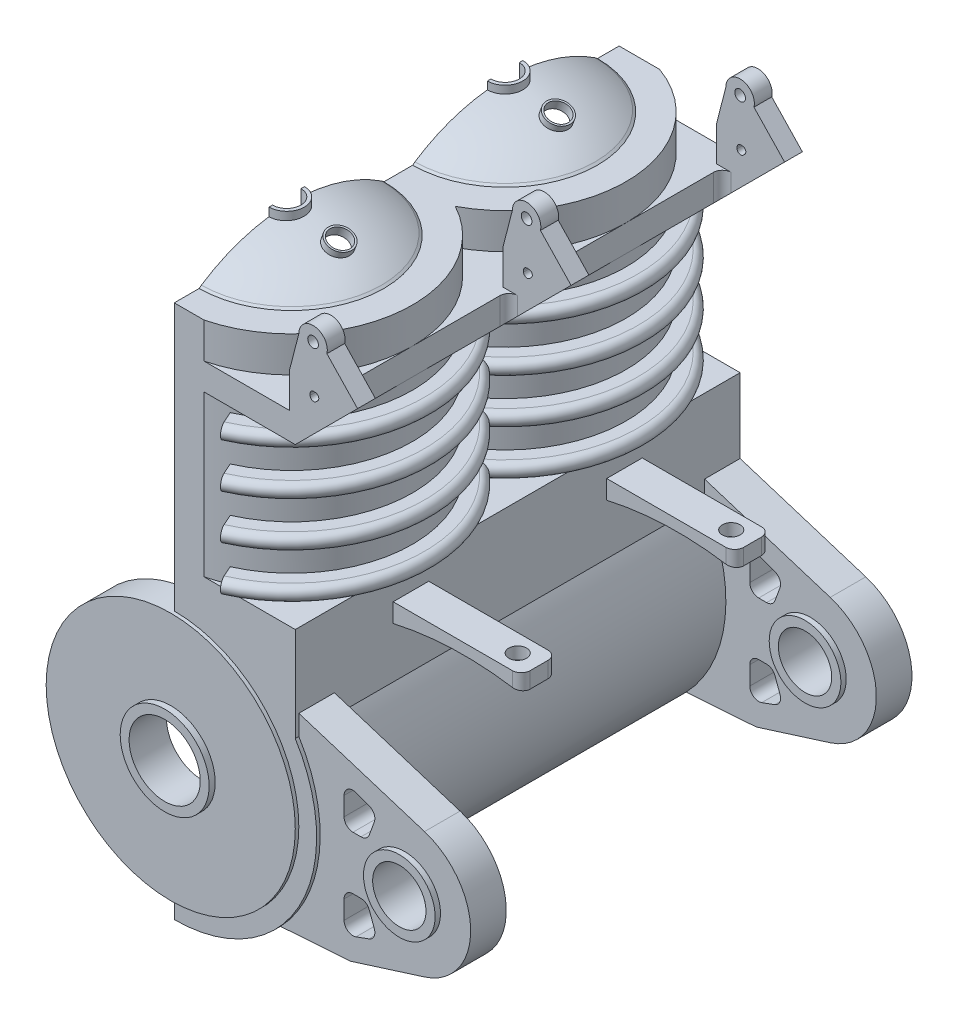
from build123d import *
from build123d.topology import SkipClean

# Parameters (mm, degrees)
BOSS_EXTRUDE1_DEPTH  = 25
SKETCH7_R            = 5
CUT_EXTRUDE1_DEPTH   = 20
SKETCH8_R            = 7
CUT_EXTRUDE3_DEPTH   = 30
CUT_EXTRUDE4_DEPTH   = 9
SKETCH10_W           = 0.505
SKETCH10_H           = 10
SKETCH10_W_2         = 0.175
SKETCH10_H_2         = 0.8
REVOLVE4_ANGLE       = 156
LPATTERN1_COUNT      = 2
LPATTERN1_PITCH      = 12
SKETCH11_R           = 5
CUT_EXTRUDE5_DEPTH   = 15
BOSS_EXTRUDE2_START  = -1
SKETCH12_R           = 7
SKETCH12_R_2         = 2.5
BOSS_EXTRUDE2_DEPTH  = 1.5
LPATTERN2_COUNT      = 3
LPATTERN2_PITCH      = 12
BOSS_EXTRUDE3_START  = 0.2
SKETCH13_R           = 2.5
BOSS_EXTRUDE3_DEPTH  = 0.2
BOSS_EXTRUDE4_START  = -1.6
SKETCH14_R           = 2.5
SKETCH14_R_2         = 2
BOSS_EXTRUDE4_DEPTH  = 2.1
LPATTERN4_COUNT      = 3
LPATTERN4_PITCH      = 12.22
BOSS_EXTRUDE5_START  = 2
BOSS_EXTRUDE5_DEPTH  = 2
SKETCH16_R           = 2.013
BOSS_EXTRUDE6_DEPTH  = 2
LPATTERN5_COUNT      = 2
LPATTERN5_PITCH      = 22.8
BOSS_EXTRUDE7_START  = 0.3
SKETCH17_R           = 2.013
SKETCH17_R_2         = 1.5
BOSS_EXTRUDE7_DEPTH  = 2.6
LPATTERN7_COUNT      = 2
LPATTERN7_PITCH      = 22.8
CUT_EXTRUDE7_DEPTH   = 38.62472532
REVOLVE6_ANGLE       = 180
LPATTERN8_COUNT      = 2
LPATTERN8_PITCH      = 12
SKETCH22_R           = 0.995
CUT_EXTRUDE8_DEPTH   = 46.655730199
BOSS_EXTRUDE8_START  = 1.2
BOSS_EXTRUDE8_DEPTH  = 0.8
SKETCH24_R           = 0.6
CUT_EXTRUDE9_DEPTH   = 44.130998955
SKETCH25_R           = 0.3
BOSS_EXTRUDE9_DEPTH  = 1
LPATTERN9_COUNT      = 3
LPATTERN9_PITCH      = 12
FILLET1_R            = 0.5
FILLET2_R            = 0.5
BOSS_EXTRUDE10_START = -5.5
BOSS_EXTRUDE10_DEPTH = 2
LPATTERN10_COUNT     = 2
LPATTERN10_PITCH     = 12
SKETCH27_R           = 0.5
CUT_EXTRUDE10_DEPTH  = 2.5
FILLET3_R            = 0.5
SKETCH28_W           = 4.347095231
SKETCH28_H           = 2.543911844
CUT_EXTRUDE11_DEPTH  = 39.271201321
SKETCH29_R           = 0.3
BOSS_EXTRUDE11_DEPTH = 1
LPATTERN11_COUNT     = 3
LPATTERN11_PITCH     = 12
EXTRUDE_THIN1_START  = 1.9
SKETCH31_R           = 0.7
SKETCH31_R_2         = 0.6
EXTRUDE_THIN1_DEPTH  = 0.5


with BuildPart() as part:
    # Sketch6 → Boss-Extrude1 (new body)
    with BuildSketch(Plane.XY):
        with BuildLine():
            Line((-15.966014508, -15.243839916), (-15.966014508, 12.776160084))
            Line((-15.966014508, 12.776160084), (-9.166014508, 12.776160084))
            Line((-9.166014508, 12.776160084), (-9.166014508, -3.029578414))
            ThreePointArc((-9.166014508, -3.029578414), (-8.976232966, -11.135234781), (-15.966014508, -15.243839916))
        make_face()
    extrude(amount=BOSS_EXTRUDE1_DEPTH)

    # Sketch7 → Cut-Extrude1 (cut)
    with BuildSketch(Plane(origin=(0, 12.776160084, 0), x_dir=(1, 0, 0), z_dir=(0, 1, 0))):
        with Locations((-15.966014508, -6.41)):
            Circle(SKETCH7_R)
        with Locations((-15.966014508, -18.41)):
            Circle(SKETCH7_R)
    extrude(amount=-CUT_EXTRUDE1_DEPTH, mode=Mode.SUBTRACT)

    # Sketch8 → Cut-Extrude3 (cut)
    with BuildSketch(Plane.XY.offset(25)):
        with Locations((-15.966014508, -7.223839916)):
            Circle(SKETCH8_R)
    extrude(amount=-CUT_EXTRUDE3_DEPTH, mode=Mode.SUBTRACT)

    # Sketch9 → Cut-Extrude4 (cut)
    with BuildSketch(Plane(origin=(0, 11.276160084, 0), x_dir=(1, 0, 0), z_dir=(0, 1, 0))):
        with BuildLine():
            Line((-15.966014508, 0.39), (-5.239812243, 0.39))
            Line((-5.239812243, 0.39), (-5.239812243, -25.21))
            Line((-5.239812243, -25.21), (-15.966014508, -25.21))
            ThreePointArc((-15.966014508, -25.21), (-9.369045507, -20.05924225), (-12.766014508, -12.41))
            ThreePointArc((-12.766014508, -12.41), (-9.369045507, -4.76075775), (-15.966014508, 0.39))
        make_face()
    extrude(amount=-CUT_EXTRUDE4_DEPTH, mode=Mode.SUBTRACT)

    # Sketch10 → Revolve4 (revolve)
    with BuildSketch(Plane.ZY.offset(15.966014508)):
        with Locations((0.4275, 6.926160084)):
            Rectangle(SKETCH10_W, SKETCH10_H)
        with BuildLine():
            Line((0, 9.826160084), (0, 10.626160084))
            Line((0, 10.626160084), (-1.07, 10.626160084))
            ThreePointArc((-1.07, 10.626160084), (-1.47, 10.226160084), (-1.07, 9.826160084))
            Line((-1.07, 9.826160084), (0, 9.826160084))
        make_face()
        with Locations((0.0875, 10.226160084)):
            Rectangle(SKETCH10_W_2, SKETCH10_H_2)
        with BuildLine():
            Line((0, 7.326160084), (0, 8.126160084))
            Line((0, 8.126160084), (-1.07, 8.126160084))
            ThreePointArc((-1.07, 8.126160084), (-1.47, 7.726160084), (-1.07, 7.326160084))
            Line((-1.07, 7.326160084), (0, 7.326160084))
        make_face()
        with Locations((0.0875, 7.726160084)):
            Rectangle(SKETCH10_W_2, SKETCH10_H_2)
        with BuildLine():
            Line((0, 4.826160084), (0, 5.626160084))
            Line((0, 5.626160084), (-1.07, 5.626160084))
            ThreePointArc((-1.07, 5.626160084), (-1.47, 5.226160084), (-1.07, 4.826160084))
            Line((-1.07, 4.826160084), (0, 4.826160084))
        make_face()
        with Locations((0.0875, 5.226160084)):
            Rectangle(SKETCH10_W_2, SKETCH10_H_2)
        with BuildLine():
            Line((-1.07, 2.326160084), (0, 2.326160084))
            Line((0, 2.326160084), (0, 3.126160084))
            Line((0, 3.126160084), (-1.07, 3.126160084))
            ThreePointArc((-1.07, 3.126160084), (-1.47, 2.726160084), (-1.07, 2.326160084))
        make_face()
        with Locations((0.0875, 2.726160084)):
            Rectangle(SKETCH10_W_2, SKETCH10_H_2)
    revolve4 = revolve(axis=Axis((-15.966014508, 12.776160084, 6.41), (0, -1, 0)), revolution_arc=REVOLVE4_ANGLE)

    # LPattern1: Revolve4 ×2
    with Locations(*[(0, 0, i * LPATTERN1_PITCH) for i in range(1, LPATTERN1_COUNT)]):
        add(revolve4)

    # Sketch11 → Cut-Extrude5 (cut)
    with BuildSketch(Plane(origin=(0, 12.776160084, 0), x_dir=(1, 0, 0), z_dir=(0, 1, 0))):
        with Locations((-15.966014508, -6.41)):
            Circle(SKETCH11_R)
    extrude(amount=-CUT_EXTRUDE5_DEPTH, mode=Mode.SUBTRACT)

    # Sketch12 → Boss-Extrude2 (add)
    with BuildSketch(Plane(origin=(0, 0, 0), x_dir=(-1, 0, 0), z_dir=(0, 0, -1)).offset(BOSS_EXTRUDE2_START)):
        with Locations((15.966014508, -7.223839916)):
            Circle(SKETCH12_R)
        with Locations((15.966014508, -7.223839916)):
            Circle(SKETCH12_R_2, mode=Mode.SUBTRACT)
    boss_extrude2 = extrude(amount=BOSS_EXTRUDE2_DEPTH)

    # LPattern2: Boss-Extrude2 ×3
    with Locations(*[(0, 0, i * LPATTERN2_PITCH) for i in range(1, LPATTERN2_COUNT)]):
        add(boss_extrude2)

    # Sketch13 → Boss-Extrude3 (add)
    with BuildSketch(Plane.XY.offset(25).offset(BOSS_EXTRUDE3_START)):
        with BuildLine():
            ThreePointArc((-15.966014508, -14.223839916), (-8.966014508, -7.223839916), (-15.966014508, -0.223839916))
            ThreePointArc((-15.966014508, -0.223839916), (-22.966014508, -7.223839916), (-15.966014508, -14.223839916))
        make_face()
        with Locations(Location((-15.966014508, -7.223839916, 0), (0, 0, 180))):
            Circle(SKETCH13_R, mode=Mode.SUBTRACT)
    extrude(amount=-BOSS_EXTRUDE3_DEPTH)

    # Sketch14 → Boss-Extrude4 (add)
    with BuildSketch(Plane(origin=(0, 0, -0.5), x_dir=(-1, 0, 0), z_dir=(0, 0, -1)).offset(BOSS_EXTRUDE4_START)):
        with Locations((15.966014508, -7.223839916)):
            Circle(SKETCH14_R)
        with Locations((15.966014508, -7.223839916)):
            Circle(SKETCH14_R_2, mode=Mode.SUBTRACT)
    boss_extrude4 = extrude(amount=BOSS_EXTRUDE4_DEPTH)

    # LPattern4: Boss-Extrude4 ×3
    with SkipClean():  # the faces are left unmerged after this step: merging them gives an invalid solid
        with Locations(*[(0, 0, i * LPATTERN4_PITCH) for i in range(1, LPATTERN4_COUNT)]):
            add(boss_extrude4)

    # Sketch15 → Boss-Extrude5 (add)
    with SkipClean():  # the faces are left unmerged after this step: merging them gives an invalid solid
        with BuildSketch(Plane(origin=(0, 12.776160084, 0), x_dir=(1, 0, 0), z_dir=(0, 1, 0)).offset(BOSS_EXTRUDE5_START)):
            with BuildLine():
                ThreePointArc((-9.166014508, -6.41), (-10.412884664, -2.485366395), (-13.696234783, 0))
                Line((-13.696234783, 0), (-15.966014508, 0))
                Line((-15.966014508, 0), (-15.966014508, -1.41))
                ThreePointArc((-15.966014508, -1.41), (-10.966014508, -6.41), (-15.966014508, -11.41))
                Line((-15.966014508, -11.41), (-15.966014508, -13.41))
                ThreePointArc((-15.966014508, -13.41), (-10.966014508, -18.41), (-15.966014508, -23.41))
                Line((-15.966014508, -23.41), (-15.966014508, -25))
                Line((-15.966014508, -25), (-14.28914242, -25))
                ThreePointArc((-14.28914242, -25), (-10.597461155, -22.583563813), (-9.166014508, -18.41))
                ThreePointArc((-9.166014508, -18.41), (-10.135062613, -14.911428863), (-12.766014508, -12.41))
                ThreePointArc((-12.766014508, -12.41), (-10.135062613, -9.908571137), (-9.166014508, -6.41))
            make_face()
        extrude(amount=-BOSS_EXTRUDE5_DEPTH)

    # Sketch16 → Boss-Extrude6 (add)
    with SkipClean():  # the faces are left unmerged after this step: merging them gives an invalid solid
        with BuildSketch(Plane(origin=(0, 0, 0), x_dir=(-1, 0, 0), z_dir=(0, 0, -1))):
            with BuildLine():
                Line((9.166014508, -1.901194809), (2.103332068, -4.128050028))
                ThreePointArc((2.103332068, -4.128050028), (-0.491049416, -7.666339916), (2.103332068, -11.204629803))
                Line((2.103332068, -11.204629803), (6.256408901, -12.514089898))
                Line((6.256408901, -12.514089898), (10.199653762, -12.789025553))
                ThreePointArc((10.199653762, -12.789025553), (8.010509639, -8.086420648), (9.166014508, -3.029578414))
                Line((9.166014508, -3.029578414), (9.166014508, -1.901194809))
            make_face()
            with Locations((3.218950584, -7.666339916)):
                Circle(SKETCH16_R, mode=Mode.SUBTRACT)
        boss_extrude6 = extrude(amount=-BOSS_EXTRUDE6_DEPTH)

    # LPattern5: Boss-Extrude6 ×2
    with SkipClean():  # the faces are left unmerged after this step: merging them gives an invalid solid
        with Locations(*[(0, 0, i * LPATTERN5_PITCH) for i in range(1, LPATTERN5_COUNT)]):
            add(boss_extrude6)

    # Sketch17 → Boss-Extrude7 (add)
    with BuildSketch(Plane(origin=(0, 0, 0), x_dir=(-1, 0, 0), z_dir=(0, 0, -1)).offset(BOSS_EXTRUDE7_START)):
        with Locations((3.218950584, -7.666339916)):
            Circle(SKETCH17_R)
        with Locations((3.218950584, -7.666339916)):
            Circle(SKETCH17_R_2, mode=Mode.SUBTRACT)
    boss_extrude7 = extrude(amount=-BOSS_EXTRUDE7_DEPTH)

    # LPattern7: Boss-Extrude7 ×2
    with SkipClean():  # the faces are left unmerged after this step: merging them gives an invalid solid
        with Locations(*[(0, 0, i * LPATTERN7_PITCH) for i in range(1, LPATTERN7_COUNT)]):
            add(boss_extrude7)

    # Sketch18 → Cut-Extrude7 (cut, through all)
    with SkipClean():  # the faces are left unmerged after this step: merging them gives an invalid solid
        with BuildSketch(Plane(origin=(0, 0, 0), x_dir=(-1, 0, 0), z_dir=(0, 0, -1))):
            with BuildLine():
                Line((5.952094635, -4.156790987), (5.220600461, -4.424410807))
                ThreePointArc((5.220600461, -4.424410807), (4.938886743, -4.68341658), (4.922829801, -5.065762999))
                Line((4.922829801, -5.065762999), (5.20614628, -5.840161376))
                ThreePointArc((5.20614628, -5.840161376), (5.389259965, -6.078184826), (5.675707706, -6.16837061))
                Line((5.675707706, -6.16837061), (6.123885401, -6.16837061))
                ThreePointArc((6.123885401, -6.16837061), (6.477438791, -6.021924001), (6.623885401, -5.66837061))
                Line((6.623885401, -5.66837061), (6.623885401, -4.626352413))
                ThreePointArc((6.623885401, -4.626352413), (6.410333142, -4.216538197), (5.952094635, -4.156790987))
            make_face()
            with BuildLine():
                Line((6.623885401, -9.664309221), (6.623885401, -10.706327418))
                ThreePointArc((6.623885401, -10.706327418), (6.410333142, -11.116141634), (5.952094635, -11.175888844))
                Line((5.952094635, -11.175888844), (5.220600461, -10.908269024))
                ThreePointArc((5.220600461, -10.908269024), (4.938886743, -10.649263251), (4.922829801, -10.266916833))
                Line((4.922829801, -10.266916833), (5.20614628, -9.492518456))
                ThreePointArc((5.20614628, -9.492518456), (5.389259965, -9.254495005), (5.675707706, -9.164309221))
                Line((5.675707706, -9.164309221), (6.123885401, -9.164309221))
                ThreePointArc((6.123885401, -9.164309221), (6.477438791, -9.310755831), (6.623885401, -9.664309221))
            make_face()
        extrude(amount=-CUT_EXTRUDE7_DEPTH, mode=Mode.SUBTRACT)

    # Sketch20 → Revolve6 (revolve)
    with SkipClean():  # the faces are left unmerged after this step: merging them gives an invalid solid
        with BuildSketch(Plane.ZY.offset(15.966014508)):
            with BuildLine():
                ThreePointArc((13.343944954, 14.876343571), (15.765441627, 16.008021329), (18.41, 16.396160084))
                Line((18.41, 16.396160084), (18.41, 16.276160084))
                ThreePointArc((18.41, 16.276160084), (15.799923373, 15.893082175), (13.41, 14.776160084))
                Line((13.41, 14.776160084), (13.217187344, 14.776160084))
                Line((13.217187344, 14.776160084), (13.343944954, 14.876343571))
            make_face()
        revolve6 = revolve(axis=Axis((-15.966014508, 14.776160084, 18.41), (0, -1, 0)), revolution_arc=REVOLVE6_ANGLE)

    # LPattern8: Revolve6 ×2
    with SkipClean():  # the faces are left unmerged after this step: merging them gives an invalid solid
        with Locations(*[(0, 0, -i * LPATTERN8_PITCH) for i in range(1, LPATTERN8_COUNT)]):
            add(revolve6)

    # Sketch22 → Cut-Extrude8 (cut, through all)
    with SkipClean():  # the faces are left unmerged after this step: merging them gives an invalid solid
        with BuildSketch(Plane(origin=(0, 14.776160084, 0), x_dir=(1, 0, 0), z_dir=(0, 1, 0))):
            with Locations((-15.966014508, -6.41)):
                Circle(SKETCH22_R)
            with Locations((-15.966014508, -18.682560137)):
                Circle(SKETCH22_R)
        extrude(amount=CUT_EXTRUDE8_DEPTH, mode=Mode.SUBTRACT)

    # Sketch23 → Boss-Extrude8 (add)
    with BuildSketch(Plane(origin=(0, 14.776160084, 0), x_dir=(1, 0, 0), z_dir=(0, 1, 0)).offset(BOSS_EXTRUDE8_START)):
        with BuildLine():
            Line((-15.966014508, -5.415), (-15.966014508, -5.61))
            ThreePointArc((-15.966014508, -5.61), (-15.166014508, -6.41), (-15.966014508, -7.21))
            Line((-15.966014508, -7.21), (-15.966014508, -7.405))
            ThreePointArc((-15.966014508, -7.405), (-14.971014508, -6.41), (-15.966014508, -5.415))
        make_face()
        with BuildLine():
            Line((-15.966014508, -17.687560137), (-15.966014508, -17.882560137))
            ThreePointArc((-15.966014508, -17.882560137), (-15.166014508, -18.682560137), (-15.966014508, -19.482560137))
            Line((-15.966014508, -19.482560137), (-15.966014508, -19.677560137))
            ThreePointArc((-15.966014508, -19.677560137), (-14.971014508, -18.682560137), (-15.966014508, -17.687560137))
        make_face()
    extrude(amount=BOSS_EXTRUDE8_DEPTH)

    # Sketch24 → Cut-Extrude9 (cut, through all)
    with BuildSketch(Plane(origin=(2.881297403, 7.916299553, 0), x_dir=(0, 0, 1), z_dir=(0.34202014332565683, 0.9396926207859126, 0))):
        with Locations(Location((6.41, -17.740930693, 0), (0, 0, 244.711427718))):
            Circle(SKETCH24_R)
        with Locations(Location((18.682560137, -17.740930693, 0), (0, 0, 245.010609621))):
            Circle(SKETCH24_R)
    extrude(amount=CUT_EXTRUDE9_DEPTH, mode=Mode.SUBTRACT)

    # Sketch25 → Boss-Extrude9 (add)
    with BuildSketch(Plane(origin=(0, 0, 0), x_dir=(-1, 0, 0), z_dir=(0, 0, -1))):
        with BuildLine():
            Line((9.166014508, 11.276160084), (9.481014508, 11.276160084))
            Line((9.481014508, 11.276160084), (9.481014508, 14.776160084))
            Line((9.481014508, 14.776160084), (7.166014508, 14.776160084))
            Line((7.166014508, 14.776160084), (6.041714726, 15.900459867))
            ThreePointArc((6.041714726, 15.900459867), (5.291714726, 15.900459867), (5.291714726, 15.150459867))
            Line((5.291714726, 15.150459867), (9.166014508, 11.276160084))
        make_face()
        with Locations((5.666714726, 15.525459867)):
            Circle(SKETCH25_R, mode=Mode.SUBTRACT)
        with BuildLine():
            Line((7.90433917, 14.037835422), (7.993117224, 13.949057369))
            ThreePointArc((7.993117224, 13.949057369), (8.211075266, 13.905702818), (8.33453858, 14.090478725))
            Line((8.33453858, 14.090478725), (8.33453858, 14.179256778))
            ThreePointArc((8.33453858, 14.179256778), (8.275959936, 14.320678134), (8.13453858, 14.379256778))
            Line((8.13453858, 14.379256778), (8.045760527, 14.379256778))
            ThreePointArc((8.045760527, 14.379256778), (7.86098462, 14.255793465), (7.90433917, 14.037835422))
        make_face(mode=Mode.SUBTRACT)
    boss_extrude9 = extrude(amount=-BOSS_EXTRUDE9_DEPTH)

    # LPattern9: Boss-Extrude9 ×3
    with Locations(*[(0, 0, i * LPATTERN9_PITCH) for i in range(1, LPATTERN9_COUNT)]):
        add(boss_extrude9)

    # Fillet1
    # the kernel refuses this fillet: 0.5 mm, written as the material it adds along each edge
    with BuildSketch(Plane(origin=(-9.166014508, 11.276160084, 12), x_dir=(0, 0, -1), z_dir=(0, 1, 0))) as fillet1_piece_1_section:
        with BuildLine():
            CenterArc((FILLET1_R, -FILLET1_R), FILLET1_R, 90, 90)
            Line((0, -FILLET1_R), (0, 0))
            Line((0, 0), (FILLET1_R, 0))
        make_face()
    fillet1_piece_1 = extrude(amount=1.5, mode=Mode.PRIVATE)
    fillet1_piece_1 = split(fillet1_piece_1, bisect_by=Plane(origin=(-8.712267809, 11.729906783, 11.881889398), z_dir=(-0.707106781186549, 0.7071067811865461, 0)), keep=Keep.TOP, mode=Mode.PRIVATE)
    add(fillet1_piece_1)
    with BuildSketch(Plane(origin=(-9.166014508, 11.276160084, 24), x_dir=(0, 0, -1), z_dir=(0, 1, 0))) as fillet1_piece_2_section:
        with BuildLine():
            CenterArc((FILLET1_R, -FILLET1_R), FILLET1_R, 90, 90)
            Line((0, -FILLET1_R), (0, 0))
            Line((0, 0), (FILLET1_R, 0))
        make_face()
    fillet1_piece_2 = extrude(amount=1.5, mode=Mode.PRIVATE)
    fillet1_piece_2 = split(fillet1_piece_2, bisect_by=Plane(origin=(-8.712267809, 11.729906783, 23.881889398), z_dir=(-0.707106781186549, 0.7071067811865461, 0)), keep=Keep.TOP, mode=Mode.PRIVATE)
    add(fillet1_piece_2)

    # Fillet2
    # the kernel refuses this fillet: 0.5 mm, written as the material it adds along each edge
    with BuildSketch(Plane(origin=(-9.166014508, 11.276160084, 1), x_dir=(1, 0, 0), z_dir=(0, 1, 0))) as fillet2_piece_1_section:
        with BuildLine():
            CenterArc((FILLET2_R, -FILLET2_R), FILLET2_R, 90, 90)
            Line((0, -FILLET2_R), (0, 0))
            Line((0, 0), (FILLET2_R, 0))
        make_face()
    fillet2_piece_1 = extrude(amount=1.5, mode=Mode.PRIVATE)
    fillet2_piece_1 = split(fillet2_piece_1, bisect_by=Plane(origin=(-8.712267809, 11.729906783, 1.118110602), z_dir=(-0.707106781186549, 0.7071067811865461, 0)), keep=Keep.TOP, mode=Mode.PRIVATE)
    add(fillet2_piece_1)
    with BuildSketch(Plane(origin=(-9.166014508, 11.276160084, 13), x_dir=(0, 0, 1), z_dir=(0, 1, 0))) as fillet2_piece_2_section:
        with BuildLine():
            CenterArc((FILLET2_R, FILLET2_R), FILLET2_R, 180, 90)
            Line((0, FILLET2_R), (0, 0))
            Line((0, 0), (FILLET2_R, 0))
        make_face()
    fillet2_piece_2 = extrude(amount=1.5, mode=Mode.PRIVATE)
    fillet2_piece_2 = split(fillet2_piece_2, bisect_by=Plane(origin=(-8.712267809, 11.729906783, 13.118110602), z_dir=(-0.7071067811865476, 0.7071067811865476, 0)), keep=Keep.TOP, mode=Mode.PRIVATE)
    add(fillet2_piece_2)

    # Sketch26 → Boss-Extrude10 (add)
    with BuildSketch(Plane(origin=(0, 0, 0), x_dir=(-1, 0, 0), z_dir=(0, 0, -1)).offset(BOSS_EXTRUDE10_START)):
        with BuildLine():
            Line((9.166014508, 0.876160084), (1.966014508, 0.876160084))
            Line((1.966014508, 0.876160084), (1.966014508, -0.023839916))
            ThreePointArc((1.966014508, -0.023839916), (5.573961221, 0.263038232), (9.166014508, -0.180506295))
            Line((9.166014508, -0.180506295), (9.166014508, 0.876160084))
        make_face()
    boss_extrude10 = extrude(amount=-BOSS_EXTRUDE10_DEPTH)

    # LPattern10: Boss-Extrude10 ×2
    with Locations(*[(0, 0, i * LPATTERN10_PITCH) for i in range(1, LPATTERN10_COUNT)]):
        add(boss_extrude10)

    # Sketch27 → Cut-Extrude10 (cut, symmetric)
    with BuildSketch(Plane(origin=(0, 0.876160084, 0), x_dir=(1, 0, 0), z_dir=(0, 1, 0))):
        with Locations(Location((-3.166014508, -6.5, 0), (0, 0, 90))):
            Circle(SKETCH27_R)
        with Locations(Location((-3.166014508, -18.5, 0), (0, 0, 90))):
            Circle(SKETCH27_R)
    extrude(amount=CUT_EXTRUDE10_DEPTH, both=True, mode=Mode.SUBTRACT)

    # Fillet3
    fillet3_edges = [part.edges().sort_by_distance(p)[0] for p in [
        (-1.966014508, 0.426160084, 7.5),
        (-1.966014508, 0.426160084, 5.5),
        (-1.966014508, 0.426160084, 19.5),
        (-1.966014508, 0.426160084, 17.5),
    ]]
    fillet(fillet3_edges, radius=FILLET3_R)

    # Sketch28 → Cut-Extrude11 (cut, through all)
    with BuildSketch(Plane(origin=(0, 0, 0), x_dir=(-1, 0, 0), z_dir=(0, 0, -1))):
        with Locations((5.140873882, 16.048116006)):
            Rectangle(SKETCH28_W, SKETCH28_H)
    extrude(amount=-CUT_EXTRUDE11_DEPTH, mode=Mode.SUBTRACT)

    # Sketch29 → Boss-Extrude11 (add)
    with BuildSketch(Plane(origin=(0, 0, 0), x_dir=(-1, 0, 0), z_dir=(0, 0, -1))):
        with BuildLine():
            Line((9.481014508, 14.776160084), (8.966014508, 16.776160084))
            ThreePointArc((8.966014508, 16.776160084), (8.071130834, 17.570513336), (7.388521787, 16.587732197))
            Line((7.388521787, 16.587732197), (5.666014508, 14.776160084))
            Line((5.666014508, 14.776160084), (9.481014508, 14.776160084))
        make_face()
        with Locations((8.166014508, 16.776160084)):
            Circle(SKETCH29_R, mode=Mode.SUBTRACT)
    boss_extrude11 = extrude(amount=-BOSS_EXTRUDE11_DEPTH)

    # LPattern11: Boss-Extrude11 ×3
    with Locations(*[(0, 0, i * LPATTERN11_PITCH) for i in range(1, LPATTERN11_COUNT)]):
        add(boss_extrude11)

    # Sketch31 → Extrude-Thin1 (add)
    # profile 1 of 2: a face of its own
    with BuildSketch(Plane(origin=(2.881297403, 7.916299553, 0), x_dir=(0, 0, 1), z_dir=(0.34202014332565683, 0.9396926207859126, 0)).offset(EXTRUDE_THIN1_START)):
        with Locations((6.41, -17.740930693)):
            Circle(SKETCH31_R)
        with Locations((6.41, -17.740930693)):
            Circle(SKETCH31_R_2, mode=Mode.SUBTRACT)
    # profile 2 of 2: a face of its own
    with BuildSketch(Plane(origin=(2.881297403, 7.916299553, 0), x_dir=(0, 0, 1), z_dir=(0.34202014332565683, 0.9396926207859126, 0)).offset(EXTRUDE_THIN1_START)):
        with Locations((18.682560137, -17.740930693)):
            Circle(SKETCH31_R)
        with Locations((18.682560137, -17.740930693)):
            Circle(SKETCH31_R_2, mode=Mode.SUBTRACT)
    extrude(amount=EXTRUDE_THIN1_DEPTH)


solid = part.part
